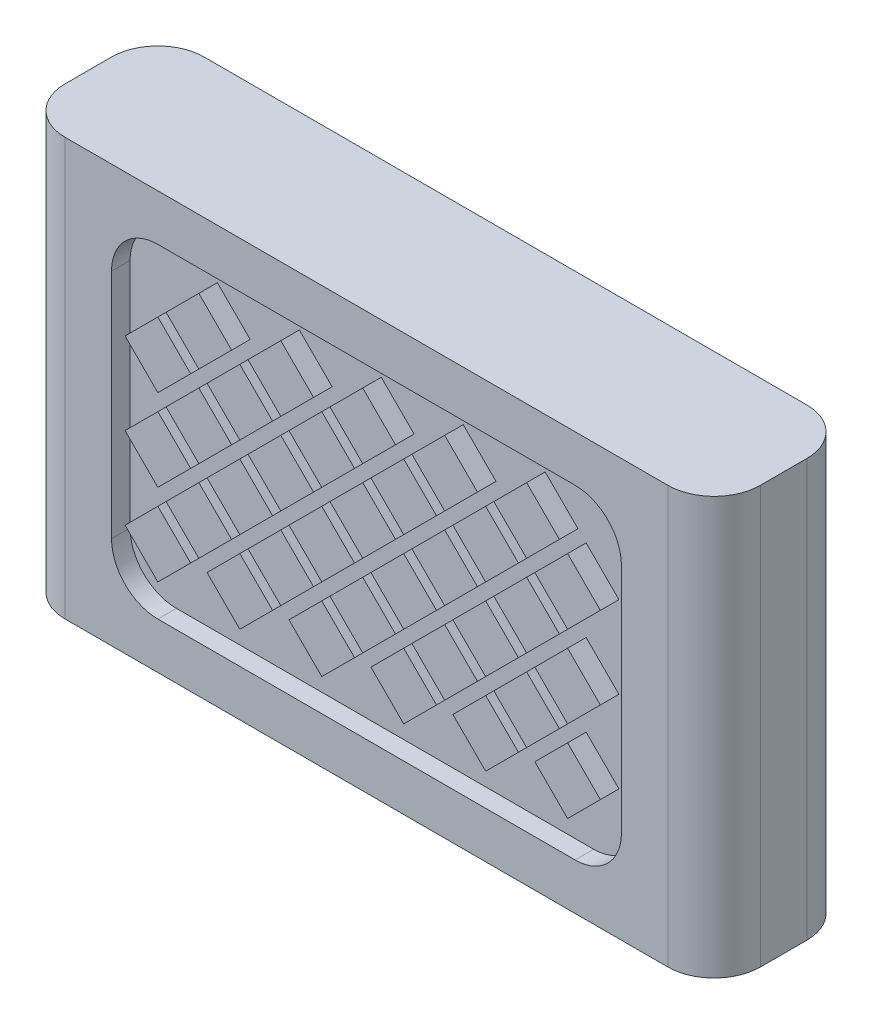
from build123d import *

# Parameters (mm, degrees)
ESBO_O1_W                          = 30
ESBO_O1_H                          = 6
CORPO_DEPTH                        = 18
FILETE10_R                         = 2
CORTE_EXTRUS_O3_DEPTH              = 0.8
RESSALTO_EXTRUS_O1_DEPTH           = 0.8
PADR_O_START                       = 2.2
PADR_O_DE_PREENCHIMENTO2_DEPTH     = 0.8
ESBO_O8_R                          = 1
RESSALTO_EXTRUS_O2_DEPTH           = 0.8
PADR_O_START_2                     = -3
PADR_O_DE_PREENCHIMENTO3_OUTLINE_R = 1
PADR_O_DE_PREENCHIMENTO3_DEPTH     = 0.8
FILETE11_R                         = 2
FILETE12_R                         = 2
FILETE13_R                         = 2


# Read off the part's stored shape, not the designer's step: Padrão de preenchimento2, Padrão de preenchimento3
with BuildPart() as part:
    # Esboço1 → Corpo (new body)
    with BuildSketch(Plane(origin=(0, 0, 0), x_dir=(1, 0, 0), z_dir=(0, 1, 0))):
        Rectangle(ESBO_O1_W, ESBO_O1_H)
    extrude(amount=CORPO_DEPTH)

    # Filete10
    filete10_edges = [part.edges().sort_by_distance(p)[0] for p in [
        (15, 9, 3),
    ]]
    fillet(filete10_edges, radius=FILETE10_R)

    # Esboço6 → Corte-extrusão3 (cut)
    with BuildSketch(Plane.XY.offset(3)):
        with BuildLine():
            Line((-9, 16), (9, 16))
            ThreePointArc((9, 16), (10.414213562, 15.414213562), (11, 14))
            Line((11, 14), (11, 4))
            ThreePointArc((11, 4), (10.414213562, 2.585786438), (9, 2))
            Line((9, 2), (-9, 2))
            ThreePointArc((-9, 2), (-10.414213562, 2.585786438), (-11, 4))
            Line((-11, 4), (-11, 14))
            ThreePointArc((-11, 14), (-10.414213562, 15.414213562), (-9, 16))
        make_face()
    corte_extrus_o3 = extrude(amount=-CORTE_EXTRUS_O3_DEPTH, mode=Mode.SUBTRACT)

    # Esboço7 → Ressalto-extrusão1 (add)
    with BuildSketch(Plane.XY.offset(2.2)):
        Polygon((-9, 6.214213562), (-10.414213562, 4.8), (-9, 3.385786438), (-7.585786438, 4.8), align=None)
    extrude(amount=RESSALTO_EXTRUS_O1_DEPTH)

    # Padrão de preenchimento2 outline → Padrão de preenchimento2 (add)
    with BuildSketch(Plane.XY.offset(PADR_O_START)):
        Polygon((-7.232233047, 7.981980515), (-8.646446609, 6.567766953), (-7.232233047, 5.153553391), (-5.818019485, 6.567766953), align=None)
        Polygon((-5.464466094, 9.749747468), (-6.878679656, 8.335533906), (-5.464466094, 6.921320344), (-4.050252532, 8.335533906), align=None)
        Polygon((-3.696699141, 11.517514421), (-5.110912703, 10.103300859), (-3.696699141, 8.689087297), (-2.282485579, 10.103300859), align=None)
        Polygon((-1.928932188, 13.285281374), (-3.343145751, 11.871067812), (-1.928932188, 10.456854249), (-0.514718626, 11.871067812), align=None)
        Polygon((-0.161165235, 15.053048327), (-1.575378798, 13.638834765), (-0.161165235, 12.224621202), (1.253048327, 13.638834765), align=None)
        Polygon((-7.585786438, 11.871067812), (-9, 13.285281374), (-10.414213562, 11.871067812), (-9, 10.456854249), align=None)
        Polygon((-5.818019485, 10.103300859), (-7.232233047, 11.517514421), (-8.646446609, 10.103300859), (-7.232233047, 8.689087297), align=None)
        Polygon((-2.282485579, 6.567766953), (-3.696699141, 7.981980515), (-5.110912703, 6.567766953), (-3.696699141, 5.153553391), align=None)
        Polygon((-0.514718626, 4.8), (-1.928932188, 6.214213562), (-3.343145751, 4.8), (-1.928932188, 3.385786438), align=None)
        Polygon((-7.232233047, 15.053048327), (-8.646446609, 13.638834765), (-7.232233047, 12.224621202), (-5.818019485, 13.638834765), align=None)
        Polygon((-4.050252532, 11.871067812), (-5.464466094, 13.285281374), (-6.878679656, 11.871067812), (-5.464466094, 10.456854249), align=None)
        Polygon((-0.514718626, 8.335533906), (-1.928932188, 9.749747468), (-3.343145751, 8.335533906), (-1.928932188, 6.921320344), align=None)
        Polygon((1.253048327, 6.567766953), (-0.161165235, 7.981980515), (-1.575378798, 6.567766953), (-0.161165235, 5.153553391), align=None)
        Polygon((3.02081528, 4.8), (1.606601718, 6.214213562), (0.192388155, 4.8), (1.606601718, 3.385786438), align=None)
        Polygon((-7.585786438, 8.335533906), (-9, 9.749747468), (-10.414213562, 8.335533906), (-9, 6.921320344), align=None)
        Polygon((-4.050252532, 4.8), (-5.464466094, 6.214213562), (-6.878679656, 4.8), (-5.464466094, 3.385786438), align=None)
        Polygon((-3.696699141, 15.053048327), (-5.110912703, 13.638834765), (-3.696699141, 12.224621202), (-2.282485579, 13.638834765), align=None)
        Polygon((1.253048327, 10.103300859), (-0.161165235, 11.517514421), (-1.575378798, 10.103300859), (-0.161165235, 8.689087297), align=None)
        Polygon((3.02081528, 8.335533906), (1.606601718, 9.749747468), (0.192388155, 8.335533906), (1.606601718, 6.921320344), align=None)
        Polygon((4.788582233, 6.567766953), (3.374368671, 7.981980515), (1.960155108, 6.567766953), (3.374368671, 5.153553391), align=None)
        Polygon((6.556349186, 4.8), (5.142135624, 6.214213562), (3.727922061, 4.8), (5.142135624, 3.385786438), align=None)
        Polygon((3.02081528, 11.871067812), (1.606601718, 13.285281374), (0.192388155, 11.871067812), (1.606601718, 10.456854249), align=None)
        Polygon((4.788582233, 10.103300859), (3.374368671, 11.517514421), (1.960155108, 10.103300859), (3.374368671, 8.689087297), align=None)
        Polygon((6.556349186, 8.335533906), (5.142135624, 9.749747468), (3.727922061, 8.335533906), (5.142135624, 6.921320344), align=None)
        Polygon((8.324116139, 6.567766953), (6.909902577, 7.981980515), (5.495689014, 6.567766953), (6.909902577, 5.153553391), align=None)
        Polygon((10.091883092, 4.8), (8.67766953, 6.214213562), (7.263455967, 4.8), (8.67766953, 3.385786438), align=None)
        Polygon((3.374368671, 15.053048327), (1.960155108, 13.638834765), (3.374368671, 12.224621202), (4.788582233, 13.638834765), align=None)
        Polygon((6.556349186, 11.871067812), (5.142135624, 13.285281374), (3.727922061, 11.871067812), (5.142135624, 10.456854249), align=None)
        Polygon((8.324116139, 10.103300859), (6.909902577, 11.517514421), (5.495689014, 10.103300859), (6.909902577, 8.689087297), align=None)
        Polygon((10.091883092, 8.335533906), (8.67766953, 9.749747468), (7.263455967, 8.335533906), (8.67766953, 6.921320344), align=None)
        Polygon((6.909902577, 15.053048327), (5.495689014, 13.638834765), (6.909902577, 12.224621202), (8.324116139, 13.638834765), align=None)
        Polygon((10.091883092, 11.871067812), (8.67766953, 13.285281374), (7.263455967, 11.871067812), (8.67766953, 10.456854249), align=None)
    extrude(amount=PADR_O_DE_PREENCHIMENTO2_DEPTH)

    # Espelhar1: Corte-extrusão3 across plane
    add(corte_extrus_o3.mirror(Plane.XY), mode=Mode.SUBTRACT)

    # Esboço8 → Ressalto-extrusão2 (add)
    with BuildSketch(Plane(origin=(0, 0, -2.2), x_dir=(-1, 0, 0), z_dir=(0, 0, -1))):
        with Locations(Location((-9, 4.5, 0), (0, 0, 180))):
            Circle(ESBO_O8_R)
    extrude(amount=RESSALTO_EXTRUS_O2_DEPTH)

    # Padrão de preenchimento3 outline → Padrão de preenchimento3 (add)
    with BuildSketch(Plane.XY.offset(PADR_O_START_2)):
        with Locations((-9.253766735, 4.5)):
            Circle(PADR_O_DE_PREENCHIMENTO3_OUTLINE_R)
        with Locations((-9.253766735, 9.016635916)):
            Circle(PADR_O_DE_PREENCHIMENTO3_OUTLINE_R)
        with Locations((-7.949926254, 6.758317958)):
            Circle(PADR_O_DE_PREENCHIMENTO3_OUTLINE_R)
        with Locations((-6.646085772, 4.5)):
            Circle(PADR_O_DE_PREENCHIMENTO3_OUTLINE_R)
        with Locations((-9.253766735, 13.533271833)):
            Circle(PADR_O_DE_PREENCHIMENTO3_OUTLINE_R)
        with Locations((-7.949926254, 11.274953874)):
            Circle(PADR_O_DE_PREENCHIMENTO3_OUTLINE_R)
        with Locations((-6.646085772, 9.016635916)):
            Circle(PADR_O_DE_PREENCHIMENTO3_OUTLINE_R)
        with Locations((-5.342245291, 6.758317958)):
            Circle(PADR_O_DE_PREENCHIMENTO3_OUTLINE_R)
        with Locations((-4.03840481, 4.5)):
            Circle(PADR_O_DE_PREENCHIMENTO3_OUTLINE_R)
        with Locations((-6.646085772, 13.533271833)):
            Circle(PADR_O_DE_PREENCHIMENTO3_OUTLINE_R)
        with Locations((-5.342245291, 11.274953874)):
            Circle(PADR_O_DE_PREENCHIMENTO3_OUTLINE_R)
        with Locations((-4.03840481, 9.016635916)):
            Circle(PADR_O_DE_PREENCHIMENTO3_OUTLINE_R)
        with Locations((-2.734564329, 6.758317958)):
            Circle(PADR_O_DE_PREENCHIMENTO3_OUTLINE_R)
        with Locations((-1.430723848, 4.5)):
            Circle(PADR_O_DE_PREENCHIMENTO3_OUTLINE_R)
        with Locations((-4.03840481, 13.533271833)):
            Circle(PADR_O_DE_PREENCHIMENTO3_OUTLINE_R)
        with Locations((-2.734564329, 11.274953874)):
            Circle(PADR_O_DE_PREENCHIMENTO3_OUTLINE_R)
        with Locations((-1.430723848, 9.016635916)):
            Circle(PADR_O_DE_PREENCHIMENTO3_OUTLINE_R)
        with Locations((-0.126883367, 6.758317958)):
            Circle(PADR_O_DE_PREENCHIMENTO3_OUTLINE_R)
        with Locations((1.176957114, 4.5)):
            Circle(PADR_O_DE_PREENCHIMENTO3_OUTLINE_R)
        with Locations((-1.430723848, 13.533271833)):
            Circle(PADR_O_DE_PREENCHIMENTO3_OUTLINE_R)
        with Locations((-0.126883367, 11.274953874)):
            Circle(PADR_O_DE_PREENCHIMENTO3_OUTLINE_R)
        with Locations((1.176957114, 9.016635916)):
            Circle(PADR_O_DE_PREENCHIMENTO3_OUTLINE_R)
        with Locations((2.480797595, 6.758317958)):
            Circle(PADR_O_DE_PREENCHIMENTO3_OUTLINE_R)
        with Locations((3.784638076, 4.5)):
            Circle(PADR_O_DE_PREENCHIMENTO3_OUTLINE_R)
        with Locations((1.176957114, 13.533271833)):
            Circle(PADR_O_DE_PREENCHIMENTO3_OUTLINE_R)
        with Locations((2.480797595, 11.274953874)):
            Circle(PADR_O_DE_PREENCHIMENTO3_OUTLINE_R)
        with Locations((3.784638076, 9.016635916)):
            Circle(PADR_O_DE_PREENCHIMENTO3_OUTLINE_R)
        with Locations((5.088478557, 6.758317958)):
            Circle(PADR_O_DE_PREENCHIMENTO3_OUTLINE_R)
        with Locations((6.392319038, 4.5)):
            Circle(PADR_O_DE_PREENCHIMENTO3_OUTLINE_R)
        with Locations((3.784638076, 13.533271833)):
            Circle(PADR_O_DE_PREENCHIMENTO3_OUTLINE_R)
        with Locations((5.088478557, 11.274953874)):
            Circle(PADR_O_DE_PREENCHIMENTO3_OUTLINE_R)
        with Locations((6.392319038, 9.016635916)):
            Circle(PADR_O_DE_PREENCHIMENTO3_OUTLINE_R)
        with Locations((7.696159519, 6.758317958)):
            Circle(PADR_O_DE_PREENCHIMENTO3_OUTLINE_R)
        with Locations((6.392319038, 13.533271833)):
            Circle(PADR_O_DE_PREENCHIMENTO3_OUTLINE_R)
        with Locations((7.696159519, 11.274953874)):
            Circle(PADR_O_DE_PREENCHIMENTO3_OUTLINE_R)
        with Locations((9, 9.016635916)):
            Circle(PADR_O_DE_PREENCHIMENTO3_OUTLINE_R)
        with Locations((9, 13.533271833)):
            Circle(PADR_O_DE_PREENCHIMENTO3_OUTLINE_R)
    extrude(amount=PADR_O_DE_PREENCHIMENTO3_DEPTH)

    # Filete11
    filete11_edges = [part.edges().sort_by_distance(p)[0] for p in [
        (15, 9, -3),
    ]]
    fillet(filete11_edges, radius=FILETE11_R)

    # Filete12
    filete12_edges = [part.edges().sort_by_distance(p)[0] for p in [
        (-15, 9, -3),
    ]]
    fillet(filete12_edges, radius=FILETE12_R)

    # Filete13
    filete13_edges = [part.edges().sort_by_distance(p)[0] for p in [
        (-15, 9, 3),
    ]]
    fillet(filete13_edges, radius=FILETE13_R)


solid = part.part
